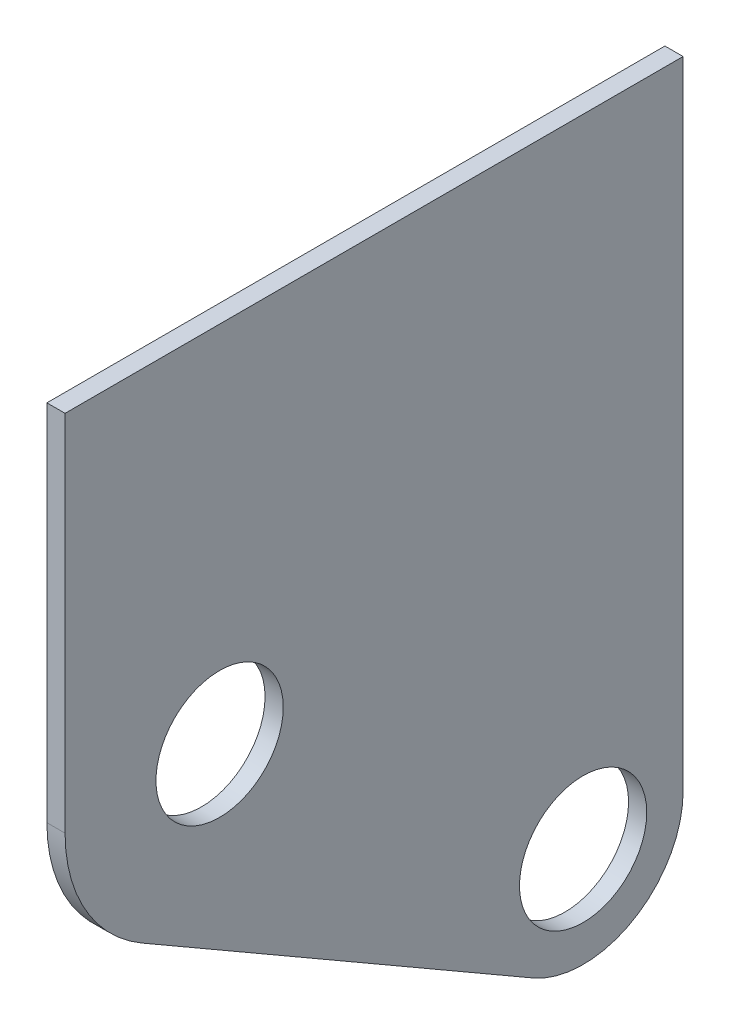
from build123d import *

# Parameters (mm, degrees)
SKETCH2_R           = 11.1125
BOSS_EXTRUDE1_DEPTH = 3.175


with BuildPart() as part:
    # Sketch2 → Boss-Extrude1 (new body)
    with BuildSketch(Plane(origin=(0, 0, 0), x_dir=(0, 0, -1), z_dir=(1, 0, 0))):
        with BuildLine():
            Line((53.965769101, 0), (-53.965769101, 0))
            Line((-53.965769101, 0), (-53.965769101, -63.5))
            ThreePointArc((-53.965769101, -63.5), (-50.350129685, -76.99375), (-40.472019101, -86.871860585))
            Line((-40.472019101, -86.871860585), (27.772019101, -126.272574411))
            ThreePointArc((27.772019101, -126.272574411), (45.234519101, -126.272574411), (53.965769101, -111.149605797))
            Line((53.965769101, -111.149605797), (53.965769101, 0))
        make_face()
        with Locations((-26.978269101, -63.5)):
            Circle(SKETCH2_R, mode=Mode.SUBTRACT)
        with Locations((36.503269101, -111.149605797)):
            Circle(SKETCH2_R, mode=Mode.SUBTRACT)
    extrude(amount=BOSS_EXTRUDE1_DEPTH)


solid = part.part
